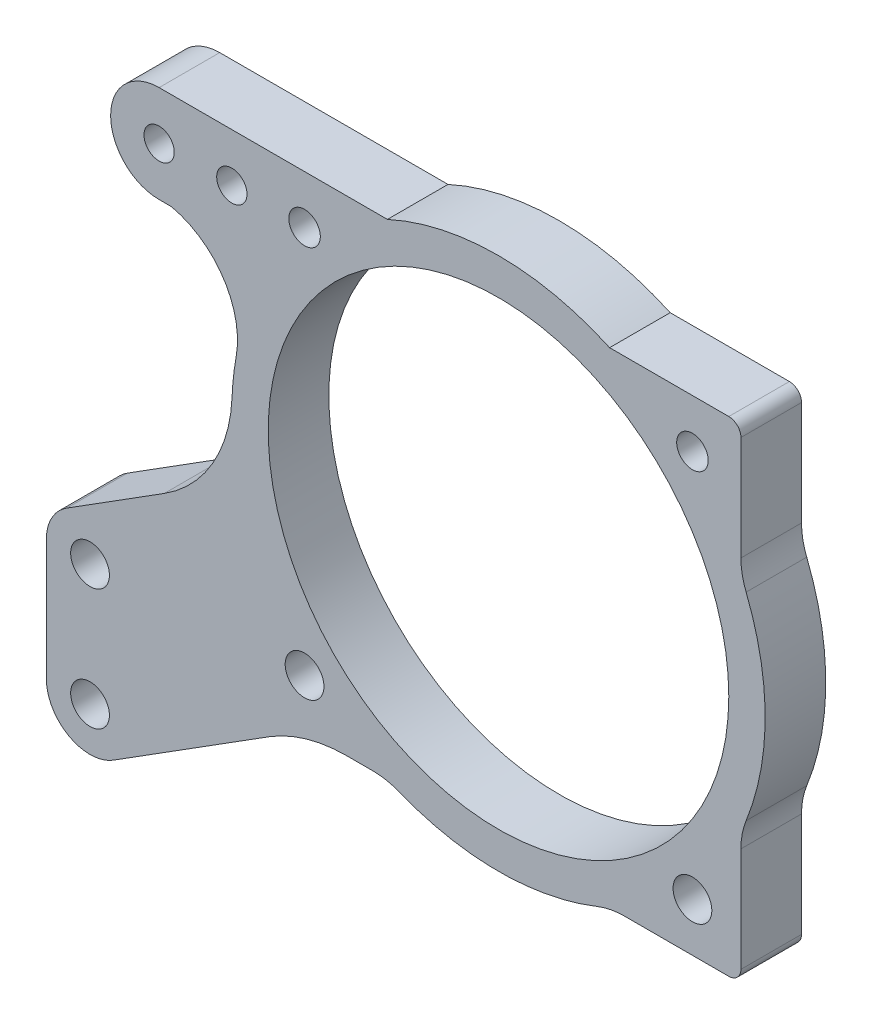
from build123d import *

# Parameters (mm, degrees)
SKETCH1_R           = 19
SKETCH1_R_2         = 1.6
SKETCH1_R_3         = 1.3
BOSS_EXTRUDE1_DEPTH = 5
FILLET1_R           = 12
FILLET3_R           = 12
FILLET4_R           = 1
FILLET5_R           = 6
SKETCH6_R           = 1.25
BOSS_EXTRUDE3_DEPTH = 5
FILLET6_R           = 10
FILLET8_R           = 7


with BuildPart() as part:
    # Sketch1 → Boss-Extrude1 (new body)
    with BuildSketch(Plane.XY):
        with BuildLine():
            Line((-37.3, -16.9), (-37.3, -26.9))
            ThreePointArc((-37.3, -26.9), (-35.439240178, -30.051990419), (-31.780531331, -29.945593543))
            Line((-31.780531331, -29.945593543), (-16, -20))
            Line((-16, -20), (-9.16515139, -20))
            ThreePointArc((-9.16515139, -20), (0, -22), (9.16515139, -20))
            Line((9.16515139, -20), (20, -20))
            Line((20, -20), (20, -9.16515139))
            ThreePointArc((20, -9.16515139), (22, 0), (20, 9.16515139))
            Line((20, 9.16515139), (20, 20))
            Line((20, 20), (9.16515139, 20))
            ThreePointArc((9.16515139, 20), (0, 22), (-9.16515139, 20))
            Line((-9.16515139, 20), (-20, 20))
            Line((-20, 20), (-20, 9.16515139))
            ThreePointArc((-20, 9.16515139), (-21.885463921, 2.241978803), (-21.442870984, -4.91968332))
            Line((-21.442870984, -4.91968332), (-35.619468669, -13.854406457))
            ThreePointArc((-35.619468669, -13.854406457), (-36.851990419, -15.160759822), (-37.3, -16.9))
        make_face()
        Circle(SKETCH1_R, mode=Mode.SUBTRACT)
        with Locations((-33.7, -16.9)):
            Circle(SKETCH1_R_2, mode=Mode.SUBTRACT)
        with Locations((-33.7, -26.9)):
            Circle(SKETCH1_R_2, mode=Mode.SUBTRACT)
        with Locations((-16, 16)):
            Circle(SKETCH1_R_3, mode=Mode.SUBTRACT)
        with Locations((16, 16)):
            Circle(SKETCH1_R_3, mode=Mode.SUBTRACT)
        with Locations((16, -16)):
            Circle(SKETCH1_R_2, mode=Mode.SUBTRACT)
        with Locations((-16, -16)):
            Circle(SKETCH1_R_2, mode=Mode.SUBTRACT)
    extrude(amount=BOSS_EXTRUDE1_DEPTH)

    # Fillet1
    fillet1_edges = [part.edges().sort_by_distance(p)[0] for p in [
        (-21.442870984, -4.91968332, 2.5),
    ]]
    fillet(fillet1_edges, radius=FILLET1_R)

    # Fillet3
    fillet3_edges = [part.edges().sort_by_distance(p)[0] for p in [
        (-16, -20, 2.5),
    ]]
    fillet(fillet3_edges, radius=FILLET3_R)

    # Fillet4
    fillet4_edges = [part.edges().sort_by_distance(p)[0] for p in [
        (20, 20, 2.5),
        (20, -20, 2.5),
    ]]
    fillet(fillet4_edges, radius=FILLET4_R)

    # Fillet5
    fillet5_edges = [part.edges().sort_by_distance(p)[0] for p in [
        (9.16515139, -20, 2.5),
        (-9.16515139, -20, 2.5),
        (20, 9.16515139, 2.5),
        (20, -9.16515139, 2.5),
    ]]
    fillet(fillet5_edges, radius=FILLET5_R)

    # Sketch6 → Boss-Extrude3 (add)
    with BuildSketch(Plane(origin=(0, 0, 0), x_dir=(-1, 0, 0), z_dir=(0, 0, -1))):
        with BuildLine():
            Line((22, 20), (20, 20))
            Line((20, 20), (20, 12))
            Line((20, 12), (22, 12))
            Line((22, 12), (28, 12))
            ThreePointArc((28, 12), (32, 16), (28, 20))
            Line((28, 20), (22, 20))
        make_face()
        with Locations((22, 16)):
            Circle(SKETCH6_R, mode=Mode.SUBTRACT)
        with Locations((28, 16)):
            Circle(SKETCH6_R, mode=Mode.SUBTRACT)
    extrude(amount=-BOSS_EXTRUDE3_DEPTH)

    # Fillet6
    # the kernel refuses this fillet: 10 mm, written as the material it adds along each edge
    with BuildSketch(Plane(origin=(-20, 12, 0), x_dir=(0, -1, 0), z_dir=(0, 0, 1))) as fillet6_piece_1:
        with BuildLine():
            CenterArc((10, -6.975715416), FILLET6_R, 135.767508297, 44.232491703)
            Line((0, -6.975715416), (-0.2, -6.975715416))
            Line((-0.2, -6.975715416), (-0.2, 0))
            Line((-0.2, 0), (0, 0.2))
            ThreePointArc((0, 0.2), (1.417424305, 0.2), (2.691545582, 0.139514308))
            Line((2.691545582, 0.139514308), (2.83484861, 0))
        make_face()
    extrude(amount=5)

    # Fillet8
    # the kernel refuses this fillet: 7 mm, written as the material it adds along each edge
    with BuildSketch(Plane(origin=(-20, 9.16515139, 0), x_dir=(-0.9264219176463756, 0.3764869592753673, 0), z_dir=(0, 0, 1))) as fillet8_piece_1:
        with BuildLine():
            CenterArc((6.404489612, 6.90896616), FILLET8_R, 191.835369606, 87.415058428)
            ThreePointArc((-0.446697133, 5.473264176), (-0.051904318, 2.750624406), (0, 0))
            ThreePointArc((0, 0), (3.764869593, -0.735780824), (7.529739186, 0))
        make_face()
    extrude(amount=5)


solid = part.part
